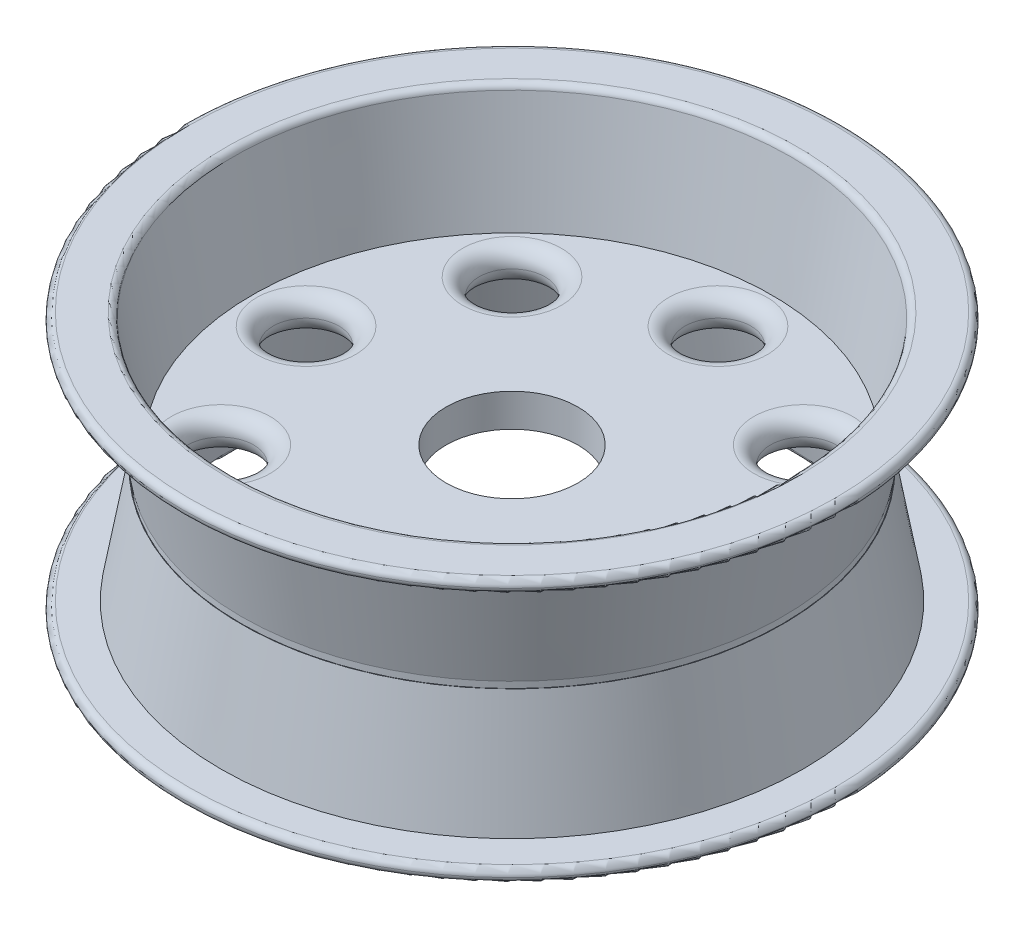
from build123d import *

# Parameters (mm, degrees)
SKETCH_1_R            = 100
SKETCH_1_R_2          = 20
SKETCH_1_R_3          = 10
EXTRUDE_3_DEPTH       = 80
SKETCH_6_R            = 85
CUT_EXTRUDE_3_DEPTH   = 35
CUT_EXTRUDE_3_DRAFT   = -10
SKETCH_7_R            = 85
CUT_EXTRUDE_4_DEPTH   = 35
CUT_EXTRUDE_4_DRAFT   = -10
SHELL_2_T             = -4
EXTRUDE_4_OUTLINE_R   = 82.048662268
EXTRUDE_4_OUTLINE_R_2 = 14
EXTRUDE_4_OUTLINE_R_3 = 24
EXTRUDE_4_DEPTH       = 2
FILLET_4_R            = 2
FILLET_5_R            = 5
FILLET_6_R            = 2


# Read off the part's stored shape, not the designer's step: 凸台-拉伸4
with BuildPart() as part:
    # 草图1 → 凸台-拉伸3 (new body)
    with BuildSketch(Plane(origin=(0, 0, 0), x_dir=(1, 0, 0), z_dir=(0, 1, 0))):
        with Locations(Location((100, 0, 0), (0, 0, 270))):
            Circle(SKETCH_1_R)
        with Locations(Location((100, 0, 0), (0, 0, 270))):
            Circle(SKETCH_1_R_2, mode=Mode.SUBTRACT)
        with Locations(Location((100, 62.5, 0), (0, 0, 270))):
            Circle(SKETCH_1_R_3, mode=Mode.SUBTRACT)
        with Locations(Location((144.194173824, 44.194173824, 0), (0, 0, 270))):
            Circle(SKETCH_1_R_3, mode=Mode.SUBTRACT)
        with Locations(Location((162.5, 0, 0), (0, 0, 270))):
            Circle(SKETCH_1_R_3, mode=Mode.SUBTRACT)
        with Locations(Location((144.194173824, -44.194173824, 0), (0, 0, 270))):
            Circle(SKETCH_1_R_3, mode=Mode.SUBTRACT)
        with Locations(Location((100, -62.5, 0), (0, 0, 270))):
            Circle(SKETCH_1_R_3, mode=Mode.SUBTRACT)
        with Locations(Location((55.805826176, -44.194173824, 0), (0, 0, 270))):
            Circle(SKETCH_1_R_3, mode=Mode.SUBTRACT)
        with Locations(Location((37.5, 0, 0), (0, 0, 270))):
            Circle(SKETCH_1_R_3, mode=Mode.SUBTRACT)
        with Locations(Location((55.805826176, 44.194173824, 0), (0, 0, 270))):
            Circle(SKETCH_1_R_3, mode=Mode.SUBTRACT)
    extrude(amount=EXTRUDE_3_DEPTH)


with BuildPart() as cut_extrude_3_tool:
    # 草图6 → 切除-拉伸3 (with draft: the straight prism first)
    with BuildSketch(Plane(origin=(0, 80, 0), x_dir=(1, 0, 0), z_dir=(0, 1, 0))):
        with Locations((100, 0)):
            Circle(SKETCH_6_R)
    extrude(amount=-CUT_EXTRUDE_3_DEPTH)
    # 切除-拉伸3: the draft: its side faces are tilted about the plane it starts from
    cut_extrude_3_sides = [cut_extrude_3_tool.faces().sort_by_distance(p)[0] for p in [
        (15, 62.5, 0),
    ]]
    draft(cut_extrude_3_sides, Plane(origin=(0, 80, 0), x_dir=(1, 0, 0), z_dir=(0, 1, 0)), CUT_EXTRUDE_3_DRAFT)


with BuildPart() as part_1:
    add(part.part)

    # 切除-拉伸3: cut by cut_extrude_3_tool
    add(cut_extrude_3_tool.part, mode=Mode.SUBTRACT)


with BuildPart() as cut_extrude_4_tool:
    # 草图7 → 切除-拉伸4 (with draft: the straight prism first)
    with BuildSketch(Plane.XZ):
        with Locations((100, 0)):
            Circle(SKETCH_7_R)
    extrude(amount=-CUT_EXTRUDE_4_DEPTH)
    # 切除-拉伸4: the draft: its side faces are tilted about the plane it starts from
    cut_extrude_4_sides = [cut_extrude_4_tool.faces().sort_by_distance(p)[0] for p in [
        (15, 17.5, 0),
    ]]
    draft(cut_extrude_4_sides, Plane.XZ, CUT_EXTRUDE_4_DRAFT)


with BuildPart() as part_2:
    add(part_1.part)

    # 切除-拉伸4: cut by cut_extrude_4_tool
    add(cut_extrude_4_tool.part, mode=Mode.SUBTRACT)

    # 抽壳2
    shell_2_openings = [part_2.faces().sort_by_distance(p)[0] for p in [
        (100, 40, -100),
    ]]
    offset(amount=SHELL_2_T, openings=shell_2_openings, kind=Kind.INTERSECTION)

    # 凸台-拉伸4 outline → 凸台-拉伸4 (add)
    with BuildSketch(Plane.XZ.offset(-41)):
        with Locations((100, 0)):
            Circle(EXTRUDE_4_OUTLINE_R)
        with Locations((55.805826176, -44.194173824)):
            Circle(EXTRUDE_4_OUTLINE_R_2, mode=Mode.SUBTRACT)
        with Locations((100, -62.5)):
            Circle(EXTRUDE_4_OUTLINE_R_2, mode=Mode.SUBTRACT)
        with Locations((144.194173824, -44.194173824)):
            Circle(EXTRUDE_4_OUTLINE_R_2, mode=Mode.SUBTRACT)
        with Locations((37.5, 0)):
            Circle(EXTRUDE_4_OUTLINE_R_2, mode=Mode.SUBTRACT)
        with Locations((55.805826176, 44.194173824)):
            Circle(EXTRUDE_4_OUTLINE_R_2, mode=Mode.SUBTRACT)
        with Locations((100, 0)):
            Circle(EXTRUDE_4_OUTLINE_R_3, mode=Mode.SUBTRACT)
        with Locations((162.5, 0)):
            Circle(EXTRUDE_4_OUTLINE_R_2, mode=Mode.SUBTRACT)
        with Locations((100, 62.5)):
            Circle(EXTRUDE_4_OUTLINE_R_2, mode=Mode.SUBTRACT)
        with Locations((144.194173824, 44.194173824)):
            Circle(EXTRUDE_4_OUTLINE_R_2, mode=Mode.SUBTRACT)
    extrude(amount=EXTRUDE_4_DEPTH)

    # 圆角4
    fillet_4_edges = [part_2.edges().sort_by_distance(p)[0] for p in [
        (100, 0, -100),
        (100, 80, -100),
        (100, 76, -100),
        (100, 4, -100),
    ]]
    fillet(fillet_4_edges, radius=FILLET_4_R - 0.0001)  # a hair under: the kernel refuses the full size

    # 圆角5
    fillet_5_edges = [part_2.edges().sort_by_distance(p)[0] for p in [
        (100, 45, -72.5),
        (144.194173824, 45, -54.194173824),
        (162.5, 45, -10),
        (144.194173824, 45, 34.194173824),
        (100, 45, 52.5),
        (55.805826176, 45, 34.194173824),
        (37.5, 45, -10),
        (55.805826176, 45, -54.194173824),
        (100, 35, -72.5),
        (144.194173824, 35, -54.194173824),
        (162.5, 35, -10),
        (144.194173824, 35, 34.194173824),
        (100, 35, 52.5),
        (55.805826176, 35, 34.194173824),
        (37.5, 35, -10),
        (55.805826176, 35, -54.194173824),
    ]]
    fillet(fillet_5_edges, radius=FILLET_5_R - 0.0001)  # a hair under: the kernel refuses the full size

    # 圆角6
    fillet_6_edges = [part_2.edges().sort_by_distance(p)[0] for p in [
        (15, 80, 0),
        (15, 0, 0),
    ]]
    fillet(fillet_6_edges, radius=FILLET_6_R)


solid = part_2.part
